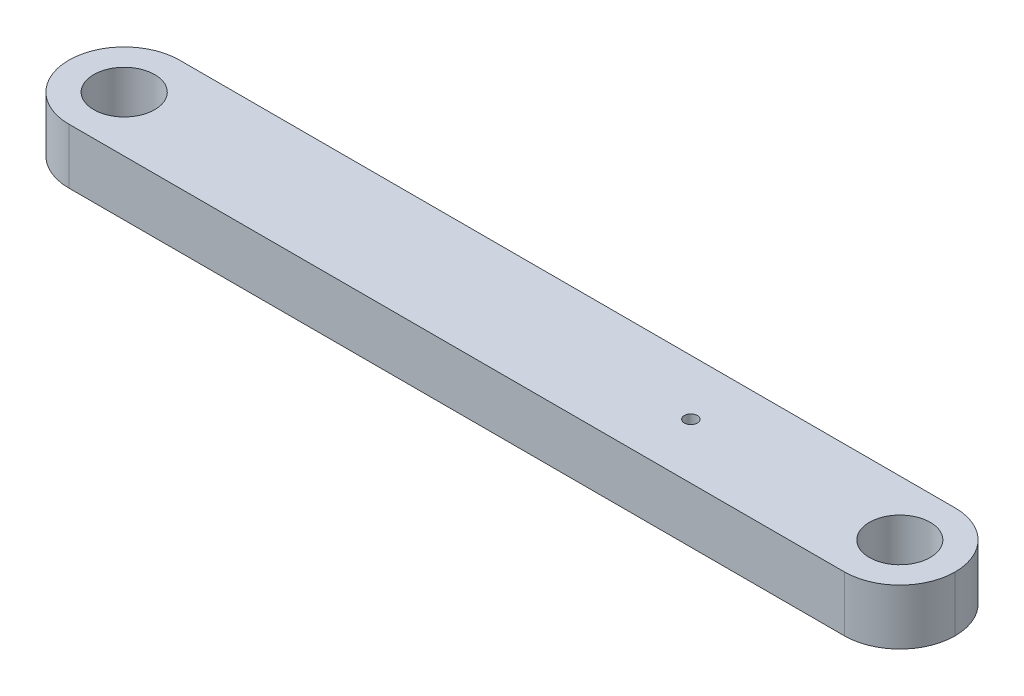
from build123d import *

# Parameters (mm, degrees)
SKETCH1_R           = 3.4925
BOSS_EXTRUDE1_DEPTH = 6.35
FILLET1_R           = 6.35
SKETCH3_R           = 0.75
CUT_EXTRUDE1_DEPTH  = 52.587643869


with BuildPart() as part:
    # Sketch1 → Boss-Extrude1 (new body)
    with BuildSketch(Plane(origin=(0, 0, 0), x_dir=(1, 0, 0), z_dir=(0, 1, 0))):
        Polygon((-50.8, 6.35), (-50.8, -6.35), (-6.35, -6.35), (6.35, -6.35), (50.8, -6.35), (50.8, 6.35), (6.35, 6.35), (-6.35, 6.35), align=None)
        with Locations(Location((-44.45, 0, 0), (0, 0, 270))):
            Circle(SKETCH1_R, mode=Mode.SUBTRACT)
        with Locations(Location((44.45, 0, 0), (0, 0, 270))):
            Circle(SKETCH1_R, mode=Mode.SUBTRACT)
    extrude(amount=BOSS_EXTRUDE1_DEPTH)

    # Fillet1
    fillet1_edges = [part.edges().sort_by_distance(p)[0] for p in [
        (50.8, 3.175, -6.35),
        (-50.8, 3.175, -6.35),
        (-50.8, 3.175, 6.35),
        (50.8, 3.175, 6.35),
    ]]
    fillet(fillet1_edges, radius=FILLET1_R - 0.0001)  # a hair under: the kernel refuses the full size

    # Sketch3 → Cut-Extrude1 (cut, through all)
    with BuildSketch(Plane(origin=(0, 6.35, 0), x_dir=(1, 0, 0), z_dir=(0, 1, 0))):
        with Locations(Location((20.5, 0, 0), (0, 0, 270))):
            Circle(SKETCH3_R)
    extrude(amount=-CUT_EXTRUDE1_DEPTH, mode=Mode.SUBTRACT)


solid = part.part
